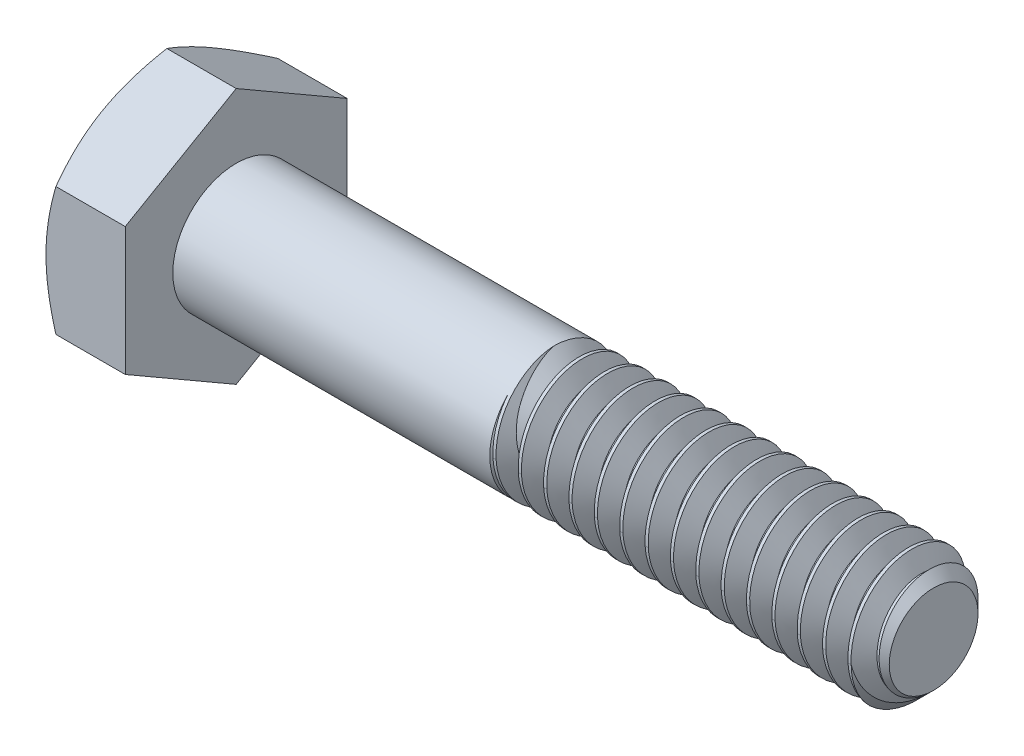
from build123d import *

# Parameters (mm, degrees)
SKETCH5_R           = 3.175
BOSS_EXTRUDE3_DEPTH = 34.925
CHAMFER1_SIZE       = 0.9525
CUT_SWEEP1_PITCH    = 1.27
BOSS_EXTRUDE4_DEPTH = 3.96875
SKETCH8_OUTSIDE_W   = 162.966
SKETCH8_OUTSIDE_H   = 164.686
SKETCH8_OUTSIDE_R   = 5.55625
CUT_EXTRUDE3_DEPTH  = 40.809022382
CUT_EXTRUDE3_DRAFT  = -60


with BuildPart() as part:
    # Sketch5 → Boss-Extrude3 (new body)
    with BuildSketch(Plane(origin=(19.446875, 0, 0), x_dir=(0, 0, -1), z_dir=(1, 0, 0))):
        Circle(SKETCH5_R)
    extrude(amount=-BOSS_EXTRUDE3_DEPTH)

    # Chamfer1
    chamfer1_edges = [part.edges().sort_by_distance(p)[0] for p in [
        (19.446875, 0, 3.175),
    ]]
    chamfer(chamfer1_edges, length=CHAMFER1_SIZE)

    # Cut-Sweep1: the profile of Sketch10 profile screwed along a right-hand helix of 16 turns, 8 arcs to a turn; built about Z, then put on its axis
    cut_sweep1_z = Axis((0, 0, 0), (0, 0, 1))
    cut_sweep1_corners = [(3.1753, 0, 0.000173205), (2.350110803, 0, -0.47625), (2.350110803, 0, -0.635), (3.1753, 0, -1.111423205)]
    with BuildLine(mode=Mode.PRIVATE) as cut_sweep1_profile:
        Line(cut_sweep1_corners[0], cut_sweep1_corners[1])
        Line(cut_sweep1_corners[1], cut_sweep1_corners[2])
        Line(cut_sweep1_corners[2], cut_sweep1_corners[3])
        Line(cut_sweep1_corners[3], cut_sweep1_corners[0])
    cut_sweep1_cap = Face(cut_sweep1_profile.wire())
    cut_sweep1_turn_angles = [0, 22.5, 45, 67.5, 90, 112.5, 135, 157.5, 180, 202.5, 225, 247.5, 270, 292.5, 315, 337.5, 360]
    cut_sweep1_turn_weights = [1, 0.9238795325112867, 1, 0.9238795325112867, 1, 0.9238795325112867, 1, 0.9238795325112867, 1, 0.9238795325112867, 1, 0.9238795325112867, 1, 0.9238795325112867, 1, 0.9238795325112867, 1]
    cut_sweep1_turn_rails = [Edge.make_bspline([Vector(p[0], p[1], 0).rotate(cut_sweep1_z, cut_sweep1_turn_angles[k]) / cut_sweep1_turn_weights[k] + Vector(0, 0, p[2] + CUT_SWEEP1_PITCH * cut_sweep1_turn_angles[k] / 360) for k in range(17)], [0, 0, 0, 1, 1, 2, 2, 3, 3, 4, 4, 5, 5, 6, 6, 7, 7, 8, 8, 8], 2, cut_sweep1_turn_weights) for p in cut_sweep1_corners]
    cut_sweep1_turn_sides = [Face.make_surface_from_curves(cut_sweep1_turn_rails[p[0]], cut_sweep1_turn_rails[p[1]]) for p in [(0, 1), (1, 2), (2, 3), (3, 0)]]
    cut_sweep1 = Plane(origin=(19.446875, 0, 0), x_dir=(0, 1, 0), z_dir=(-1, 0, 0)) * Solid(Shell([*[p.moved(Location((0, 0, CUT_SWEEP1_PITCH * i))) for i in range(16) for p in cut_sweep1_turn_sides], cut_sweep1_cap, cut_sweep1_cap.rotate(cut_sweep1_z, 5760).moved(Location((0, 0, CUT_SWEEP1_PITCH * 5760 / 360)))]))
    add(cut_sweep1, mode=Mode.SUBTRACT)

    # Sketch11 → Revolve1 (revolve)
    with BuildSketch(Plane.XY, mode=Mode.PRIVATE) as revolve1_sk:
        Polygon((-15.478125, 3.175), (-15.478125, 0), (3.571875, 0), (0.396875, 3.175), align=None)
    revolve(revolve1_sk.sketch.rotate(Axis((-15.478125, 0, 0), (1, 0, 0)), 270), axis=Axis((-15.478125, 0, 0), (1, 0, 0)))

    # Sketch6 → Boss-Extrude4 (add)
    with BuildSketch(Plane.ZY.offset(15.478125)):
        Polygon((5.55625, 3.207902433), (0, 6.415804866), (-5.55625, 3.207902433), (-5.55625, -3.207902433), (0, -6.415804866), (5.55625, -3.207902433), align=None)
    extrude(amount=BOSS_EXTRUDE4_DEPTH)


with BuildPart() as cut_extrude3_tool:
    # Sketch8 outside → Cut-Extrude3 (with draft: the straight prism first)
    with BuildSketch(Plane.ZY.offset(19.446875)):
        Rectangle(SKETCH8_OUTSIDE_W, SKETCH8_OUTSIDE_H)
        Circle(SKETCH8_OUTSIDE_R, mode=Mode.SUBTRACT)
    extrude(amount=-CUT_EXTRUDE3_DEPTH)
    # Cut-Extrude3: the draft: its side faces are tilted about the plane it starts from
    cut_extrude3_sides = [cut_extrude3_tool.faces().sort_by_distance(p)[0] for p in [
        (0.957636191, -82.343, 0),
        (0.957636191, 0, 81.483),
        (0.957636191, 82.343, 0),
        (0.957636191, 0, -81.483),
        (0.957636191, 0, -5.55625),
    ]]
    draft(cut_extrude3_sides, Plane.ZY.offset(19.446875), CUT_EXTRUDE3_DRAFT)


with BuildPart() as part_1:
    add(part.part)

    # Cut-Extrude3: cut by cut_extrude3_tool
    add(cut_extrude3_tool.part, mode=Mode.SUBTRACT)


solid = part_1.part
